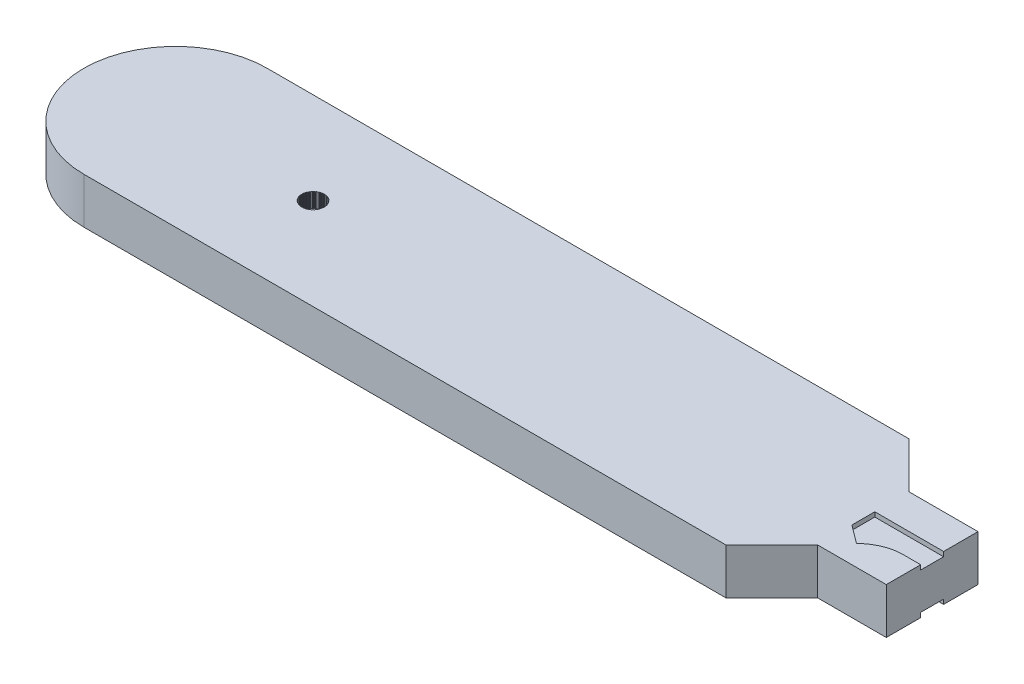
from build123d import *

# Parameters (mm, degrees)
BOSS_EXTRUDE1_DEPTH     = 10
CUT_EXTRUDE4_DEPTH      = 3.2
SKETCH2_R               = 5.5
CUT_EXTRUDE2_DEPTH      = 1.2
CUT_EXTRUDE3_DEPTH      = 1
CUT_EXTRUDE5_DEPTH      = 98.59610648
CUT_EXTRUDE5_DEPTH_BACK = 98.59610648
SKETCH6_W               = 15
SKETCH6_H               = 10
FILLET1_START           = -1
FILLET1_DEPTH           = 2
FILLET1_START_2         = 9
FILLET1_2_DEPTH         = 2
SKETCH7_W               = 40
SKETCH7_H               = 10
BOSS_EXTRUDE2_DEPTH     = 30
FILLET2_R               = 20
CHAMFER1_SIZE           = 10


with BuildPart() as part:
    # Sketch1 → Boss-Extrude1 (new body)
    with BuildSketch(Plane(origin=(0, 0, 0), x_dir=(1, 0, 0), z_dir=(0, 1, 0))):
        Polygon((-75, -20), (40, -20), (60, -20), (60, 0), (60, 20), (40, 20), (-75, 20), (-95, 20), (-95, -20), align=None)
    extrude(amount=BOSS_EXTRUDE1_DEPTH)

    # Sketch5 → Cut-Extrude4 (cut)
    with BuildSketch(Plane.XZ.offset(-10)):
        with BuildLine():
            Line((-74.866729582, 2.448604002), (-74.965733947, 2.352228083))
            Line((-74.965733947, 2.352228083), (-75.034266053, 2.352228083))
            Line((-75.034266053, 2.352228083), (-75.128339702, 2.448867388))
            ThreePointArc((-75.128339702, 2.448867388), (-75.213453001, 2.442920461), (-75.298307903, 2.43401622))
            Line((-75.298307903, 2.43401622), (-75.216789967, 2.390434282))
            Line((-75.216789967, 2.390434282), (-75.284946647, 2.383270726))
            Line((-75.284946647, 2.383270726), (-75.340727677, 2.428441314))
            ThreePointArc((-75.340727677, 2.428441314), (-75.442070784, 2.412052235), (-75.542639125, 2.391435833))
            Line((-75.542639125, 2.391435833), (-75.465470791, 2.354678511))
            Line((-75.465470791, 2.354678511), (-75.532505306, 2.340429885))
            Line((-75.532505306, 2.340429885), (-75.592702374, 2.379522318))
            ThreePointArc((-75.592702374, 2.379522318), (-75.686868648, 2.354067549), (-75.779948068, 2.324887863))
            Line((-75.779948068, 2.324887863), (-75.709051819, 2.293124389))
            Line((-75.709051819, 2.293124389), (-75.774229726, 2.271946803))
            Line((-75.774229726, 2.271946803), (-75.8381833, 2.304532777))
            ThreePointArc((-75.8381833, 2.304532777), (-75.923935855, 2.271511633), (-76.008391043, 2.23530089))
            Line((-76.008391043, 2.23530089), (-75.944864328, 2.206446317))
            Line((-75.944864328, 2.206446317), (-76.007471522, 2.178571798))
            Line((-76.007471522, 2.178571798), (-76.074480913, 2.204294293))
            ThreePointArc((-76.074480913, 2.204294293), (-76.151031117, 2.165305967), (-76.226168708, 2.123660251))
            Line((-76.226168708, 2.123660251), (-76.170324705, 2.095593957))
            Line((-76.170324705, 2.095593957), (-76.22967525, 2.061327903))
            Line((-76.22967525, 2.061327903), (-76.29900629, 2.0799051))
            ThreePointArc((-76.29900629, 2.0799051), (-76.365981918, 2.036545105), (-76.431511514, 1.991029218))
            Line((-76.431511514, 1.991029218), (-76.38296276, 1.961781831))
            Line((-76.38296276, 1.961781831), (-76.438406398, 1.921499669))
            Line((-76.438406398, 1.921499669), (-76.509299481, 1.932728031))
            ThreePointArc((-76.509299481, 1.932728031), (-76.566697253, 1.886500008), (-76.622679929, 1.838568033))
            Line((-76.622679929, 1.838568033), (-76.580448785, 1.806476012))
            Line((-76.580448785, 1.806476012), (-76.631378065, 1.760619083))
            Line((-76.631378065, 1.760619083), (-76.703056471, 1.764375589))
            ThreePointArc((-76.703056471, 1.764375589), (-76.751184067, 1.716617874), (-76.79797294, 1.667547862))
            Line((-76.79797294, 1.667547862), (-76.760619083, 1.631378065))
            Line((-76.760619083, 1.631378065), (-76.806476012, 1.580448785))
            Line((-76.806476012, 1.580448785), (-76.878154419, 1.576692279))
            ThreePointArc((-76.878154419, 1.576692279), (-76.917564529, 1.528518512), (-76.955739337, 1.479360067))
            Line((-76.955739337, 1.479360067), (-76.921499669, 1.438406398))
            Line((-76.921499669, 1.438406398), (-76.961781831, 1.38296276))
            Line((-76.961781831, 1.38296276), (-77.032674913, 1.371734398))
            ThreePointArc((-77.032674913, 1.371734398), (-77.064092329, 1.323988453), (-77.094388447, 1.275523264))
            Line((-77.094388447, 1.275523264), (-77.061327903, 1.22967525))
            Line((-77.061327903, 1.22967525), (-77.095593957, 1.170324705))
            Line((-77.095593957, 1.170324705), (-77.164924996, 1.151747509))
            ThreePointArc((-77.164924996, 1.151747509), (-77.189167426, 1.104974454), (-77.212399475, 1.057691414))
            Line((-77.212399475, 1.057691414), (-77.178571798, 1.007471522))
            Line((-77.178571798, 1.007471522), (-77.206446317, 0.944864328))
            Line((-77.206446317, 0.944864328), (-77.273455708, 0.919141833))
            ThreePointArc((-77.273455708, 0.919141833), (-77.291349904, 0.873577805), (-77.308331022, 0.827665666))
            Line((-77.308331022, 0.827665666), (-77.271946803, 0.774229726))
            Line((-77.271946803, 0.774229726), (-77.293124389, 0.709051819))
            Line((-77.293124389, 0.709051819), (-77.357077963, 0.676465846))
            ThreePointArc((-77.357077963, 0.676465846), (-77.369374437, 0.632050108), (-77.380834041, 0.587411127))
            Line((-77.380834041, 0.587411127), (-77.340429885, 0.532505306))
            Line((-77.340429885, 0.532505306), (-77.354678511, 0.465470791))
            Line((-77.354678511, 0.465470791), (-77.414875578, 0.426378358))
            ThreePointArc((-77.414875578, 0.426378358), (-77.422167277, 0.382790083), (-77.428672276, 0.339077482))
            Line((-77.428672276, 0.339077482), (-77.383270726, 0.284946647))
            Line((-77.383270726, 0.284946647), (-77.390434282, 0.216789967))
            Line((-77.390434282, 0.216789967), (-77.446215312, 0.17161938))
            ThreePointArc((-77.446215312, 0.17161938), (-77.448867388, 0.128339702), (-77.450753798, 0.085019897))
            Line((-77.450753798, 0.085019897), (-77.399999955, 0.034266053))
            Line((-77.399999955, 0.034266053), (-77.399999955, -0.034266053))
            Line((-77.399999955, -0.034266053), (-77.450753798, -0.085019897))
            ThreePointArc((-77.450753798, -0.085019897), (-77.448852521, -0.128623065), (-77.446175529, -0.17218549))
            Line((-77.446175529, -0.17218549), (-77.390434282, -0.216789967))
            Line((-77.390434282, -0.216789967), (-77.383270726, -0.284946647))
            Line((-77.383270726, -0.284946647), (-77.428441314, -0.340727677))
            ThreePointArc((-77.428441314, -0.340727677), (-77.42176959, -0.385298088), (-77.414279914, -0.429738364))
            Line((-77.414279914, -0.429738364), (-77.354678511, -0.465470791))
            Line((-77.354678511, -0.465470791), (-77.340429885, -0.532505306))
            Line((-77.340429885, -0.532505306), (-77.379522318, -0.592702374))
            ThreePointArc((-77.379522318, -0.592702374), (-77.367567191, -0.638786474), (-77.354719646, -0.684629793))
            Line((-77.354719646, -0.684629793), (-77.293124389, -0.709051819))
            Line((-77.293124389, -0.709051819), (-77.271946803, -0.774229726))
            Line((-77.271946803, -0.774229726), (-77.304532777, -0.8381833))
            ThreePointArc((-77.304532777, -0.8381833), (-77.286526732, -0.886125312), (-77.267523456, -0.933680855))
            Line((-77.267523456, -0.933680855), (-77.206446317, -0.944864328))
            Line((-77.206446317, -0.944864328), (-77.178571798, -1.007471522))
            Line((-77.178571798, -1.007471522), (-77.204294293, -1.074480913))
            ThreePointArc((-77.204294293, -1.074480913), (-77.179288011, -1.124333727), (-77.153154428, -1.173604947))
            Line((-77.153154428, -1.173604947), (-77.095593957, -1.170324705))
            Line((-77.095593957, -1.170324705), (-77.061327903, -1.22967525))
            Line((-77.061327903, -1.22967525), (-77.0799051, -1.29900629))
            ThreePointArc((-77.0799051, -1.29900629), (-77.046865484, -1.350468161), (-77.012552857, -1.401090134))
            Line((-77.012552857, -1.401090134), (-76.961781831, -1.38296276))
            Line((-76.961781831, -1.38296276), (-76.921499669, -1.438406398))
            Line((-76.921499669, -1.438406398), (-76.932728031, -1.509299481))
            ThreePointArc((-76.932728031, -1.509299481), (-76.890652821, -1.561683218), (-76.847158267, -1.612894572))
            Line((-76.847158267, -1.612894572), (-76.806476012, -1.580448785))
            Line((-76.806476012, -1.580448785), (-76.760619083, -1.631378065))
            Line((-76.760619083, -1.631378065), (-76.764375589, -1.703056471))
            ThreePointArc((-76.764375589, -1.703056471), (-76.712415138, -1.755293981), (-76.658908795, -1.805946891))
            Line((-76.658908795, -1.805946891), (-76.631378065, -1.760619083))
            Line((-76.631378065, -1.760619083), (-76.580448785, -1.806476012))
            Line((-76.580448785, -1.806476012), (-76.576692279, -1.878154419))
            ThreePointArc((-76.576692279, -1.878154419), (-76.514269593, -1.928836479), (-76.450218857, -1.977444773))
            Line((-76.450218857, -1.977444773), (-76.438406398, -1.921499669))
            Line((-76.438406398, -1.921499669), (-76.38296276, -1.961781831))
            Line((-76.38296276, -1.961781831), (-76.371734398, -2.032674913))
            ThreePointArc((-76.371734398, -2.032674913), (-76.298655216, -2.080124322), (-76.223936466, -2.12494755))
            Line((-76.223936466, -2.12494755), (-76.22967525, -2.061327903))
            Line((-76.22967525, -2.061327903), (-76.170324705, -2.095593957))
            Line((-76.170324705, -2.095593957), (-76.151747509, -2.164924996))
            ThreePointArc((-76.151747509, -2.164924996), (-76.068291818, -2.207300422), (-75.983279809, -2.246460189))
            Line((-75.983279809, -2.246460189), (-76.007471522, -2.178571798))
            Line((-76.007471522, -2.178571798), (-75.944864328, -2.206446317))
            Line((-75.944864328, -2.206446317), (-75.919141833, -2.273455708))
            ThreePointArc((-75.919141833, -2.273455708), (-75.826126742, -2.308882234), (-75.731750645, -2.340504979))
            Line((-75.731750645, -2.340504979), (-75.774229726, -2.271946803))
            Line((-75.774229726, -2.271946803), (-75.709051819, -2.293124389))
            Line((-75.709051819, -2.293124389), (-75.676465846, -2.357077963))
            ThreePointArc((-75.676465846, -2.357077963), (-75.575268296, -2.383797171), (-75.47302276, -2.406173733))
            Line((-75.47302276, -2.406173733), (-75.532505306, -2.340429885))
            Line((-75.532505306, -2.340429885), (-75.465470791, -2.354678511))
            Line((-75.465470791, -2.354678511), (-75.426378358, -2.414875578))
            ThreePointArc((-75.426378358, -2.414875578), (-75.318907018, -2.431403068), (-75.210808662, -2.443150071))
            Line((-75.210808662, -2.443150071), (-75.284946647, -2.383270726))
            Line((-75.284946647, -2.383270726), (-75.216789967, -2.390434282))
            Line((-75.216789967, -2.390434282), (-75.17161938, -2.446215312))
            ThreePointArc((-75.17161938, -2.446215312), (-75.060229867, -2.451488309), (-74.948715802, -2.451691762))
            Line((-74.948715802, -2.451691762), (-75.034266053, -2.399999955))
            Line((-75.034266053, -2.399999955), (-74.965733947, -2.399999955))
            Line((-74.965733947, -2.399999955), (-74.914980103, -2.450753798))
            ThreePointArc((-74.914980103, -2.450753798), (-74.802336284, -2.444248682), (-74.690110935, -2.432568875))
            Line((-74.690110935, -2.432568875), (-74.783210033, -2.390434282))
            Line((-74.783210033, -2.390434282), (-74.715053353, -2.383270726))
            Line((-74.715053353, -2.383270726), (-74.659272323, -2.428441314))
            ThreePointArc((-74.659272323, -2.428441314), (-74.548166734, -2.410242574), (-74.438013562, -2.386963302))
            Line((-74.438013562, -2.386963302), (-74.534529209, -2.354678511))
            Line((-74.534529209, -2.354678511), (-74.467494694, -2.340429885))
            Line((-74.467494694, -2.340429885), (-74.407297626, -2.379522318))
            ThreePointArc((-74.407297626, -2.379522318), (-74.300452623, -2.350331047), (-74.195034766, -2.316344866))
            Line((-74.195034766, -2.316344866), (-74.290948181, -2.293124389))
            Line((-74.290948181, -2.293124389), (-74.225770274, -2.271946803))
            Line((-74.225770274, -2.271946803), (-74.1618167, -2.304532777))
            ThreePointArc((-74.1618167, -2.304532777), (-74.061691973, -2.265612635), (-73.963367856, -2.222344789))
            Line((-73.963367856, -2.222344789), (-74.055135672, -2.206446317))
            Line((-74.055135672, -2.206446317), (-73.992528478, -2.178571798))
            Line((-73.992528478, -2.178571798), (-73.925519087, -2.204294293))
            ThreePointArc((-73.925519087, -2.204294293), (-73.834149531, -2.157363031), (-73.744825535, -2.106646535))
            Line((-73.744825535, -2.106646535), (-73.829675295, -2.095593957))
            Line((-73.829675295, -2.095593957), (-73.77032475, -2.061327903))
            Line((-73.77032475, -2.061327903), (-73.70099371, -2.0799051))
            ThreePointArc((-73.70099371, -2.0799051), (-73.619874896, -2.026987237), (-73.54090899, -1.970907402))
            Line((-73.54090899, -1.970907402), (-73.61703724, -1.961781831))
            Line((-73.61703724, -1.961781831), (-73.561593602, -1.921499669))
            Line((-73.561593602, -1.921499669), (-73.490700519, -1.932728031))
            ThreePointArc((-73.490700519, -1.932728031), (-73.420729585, -1.875987079), (-73.352889969, -1.816714372))
            Line((-73.352889969, -1.816714372), (-73.419551215, -1.806476012))
            Line((-73.419551215, -1.806476012), (-73.368621935, -1.760619083))
            Line((-73.368621935, -1.760619083), (-73.296943529, -1.764375589))
            ThreePointArc((-73.296943529, -1.764375589), (-73.238414289, -1.70594207), (-73.181888817, -1.645568076))
            Line((-73.181888817, -1.645568076), (-73.239380917, -1.631378065))
            Line((-73.239380917, -1.631378065), (-73.193523988, -1.580448785))
            Line((-73.193523988, -1.580448785), (-73.121845581, -1.576692279))
            ThreePointArc((-73.121845581, -1.576692279), (-73.074490972, -1.518498451), (-73.028938772, -1.458883203))
            Line((-73.028938772, -1.458883203), (-73.078500331, -1.438406398))
            Line((-73.078500331, -1.438406398), (-73.038218169, -1.38296276))
            Line((-73.038218169, -1.38296276), (-72.967325087, -1.371734398))
            ThreePointArc((-72.967325087, -1.371734398), (-72.930399333, -1.315361411), (-72.895036572, -1.257995043))
            Line((-72.895036572, -1.257995043), (-72.938672097, -1.22967525))
            Line((-72.938672097, -1.22967525), (-72.904406043, -1.170324705))
            Line((-72.904406043, -1.170324705), (-72.835075004, -1.151747509))
            ThreePointArc((-72.835075004, -1.151747509), (-72.80747115, -1.098289492), (-72.781187072, -1.044170367))
            Line((-72.781187072, -1.044170367), (-72.821428202, -1.007471522))
            Line((-72.821428202, -1.007471522), (-72.793553683, -0.944864328))
            Line((-72.793553683, -0.944864328), (-72.726544292, -0.919141833))
            ThreePointArc((-72.726544292, -0.919141833), (-72.706946554, -0.869096346), (-72.688450313, -0.818633379))
            Line((-72.688450313, -0.818633379), (-72.728053197, -0.774229726))
            Line((-72.728053197, -0.774229726), (-72.706875611, -0.709051819))
            Line((-72.706875611, -0.709051819), (-72.642922037, -0.676465846))
            ThreePointArc((-72.642922037, -0.676465846), (-72.629991905, -0.629669908), (-72.617990732, -0.582627161))
            Line((-72.617990732, -0.582627161), (-72.659570115, -0.532505306))
            Line((-72.659570115, -0.532505306), (-72.645321489, -0.465470791))
            Line((-72.645321489, -0.465470791), (-72.585124422, -0.426378358))
            ThreePointArc((-72.585124422, -0.426378358), (-72.577710835, -0.382018013), (-72.57111206, -0.337529165))
            Line((-72.57111206, -0.337529165), (-72.616729274, -0.284946647))
            Line((-72.616729274, -0.284946647), (-72.609565718, -0.216789967))
            Line((-72.609565718, -0.216789967), (-72.553784688, -0.17161938))
            ThreePointArc((-72.553784688, -0.17161938), (-72.551132612, -0.128339702), (-72.549246202, -0.085019897))
            Line((-72.549246202, -0.085019897), (-72.600000045, -0.034266053))
            Line((-72.600000045, -0.034266053), (-72.600000045, 0.034266053))
            Line((-72.600000045, 0.034266053), (-72.549246202, 0.085019897))
            ThreePointArc((-72.549246202, 0.085019897), (-72.551161797, 0.128895378), (-72.553862825, 0.172729519))
            Line((-72.553862825, 0.172729519), (-72.609565718, 0.216789967))
            Line((-72.609565718, 0.216789967), (-72.616729274, 0.284946647))
            Line((-72.616729274, 0.284946647), (-72.571558686, 0.340727677))
            ThreePointArc((-72.571558686, 0.340727677), (-72.578484541, 0.386892033), (-72.586287893, 0.432916188))
            Line((-72.586287893, 0.432916188), (-72.645321489, 0.465470791))
            Line((-72.645321489, 0.465470791), (-72.659570115, 0.532505306))
            Line((-72.659570115, 0.532505306), (-72.620477682, 0.592702374))
            ThreePointArc((-72.620477682, 0.592702374), (-72.633446854, 0.642533088), (-72.647459431, 0.692080512))
            Line((-72.647459431, 0.692080512), (-72.706875611, 0.709051819))
            Line((-72.706875611, 0.709051819), (-72.728053197, 0.774229726))
            Line((-72.728053197, 0.774229726), (-72.695467223, 0.8381833))
            ThreePointArc((-72.695467223, 0.8381833), (-72.715937257, 0.892457255), (-72.737685291, 0.946231854))
            Line((-72.737685291, 0.946231854), (-72.793553683, 0.944864328))
            Line((-72.793553683, 0.944864328), (-72.821428202, 1.007471522))
            Line((-72.821428202, 1.007471522), (-72.795705707, 1.074480913))
            ThreePointArc((-72.795705707, 1.074480913), (-72.825307638, 1.133197112), (-72.856473251, 1.191098501))
            Line((-72.856473251, 1.191098501), (-72.904406043, 1.170324705))
            Line((-72.904406043, 1.170324705), (-72.938672097, 1.22967525))
            Line((-72.938672097, 1.22967525), (-72.9200949, 1.29900629))
            ThreePointArc((-72.9200949, 1.29900629), (-72.960349747, 1.361341034), (-73.002472161, 1.422429293))
            Line((-73.002472161, 1.422429293), (-73.038218169, 1.38296276))
            Line((-73.038218169, 1.38296276), (-73.078500331, 1.438406398))
            Line((-73.078500331, 1.438406398), (-73.067271969, 1.509299481))
            ThreePointArc((-73.067271969, 1.509299481), (-73.119323707, 1.573683336), (-73.173519215, 1.636273359))
            Line((-73.173519215, 1.636273359), (-73.193523988, 1.580448785))
            Line((-73.193523988, 1.580448785), (-73.239380917, 1.631378065))
            Line((-73.239380917, 1.631378065), (-73.235624411, 1.703056471))
            ThreePointArc((-73.235624411, 1.703056471), (-73.300024726, 1.767344514), (-73.36676587, 1.829198962))
            Line((-73.36676587, 1.829198962), (-73.368621935, 1.760619083))
            Line((-73.368621935, 1.760619083), (-73.419551215, 1.806476012))
            Line((-73.419551215, 1.806476012), (-73.423307721, 1.878154419))
            ThreePointArc((-73.423307721, 1.878154419), (-73.499876853, 1.939859043), (-73.578858361, 1.998444146))
            Line((-73.578858361, 1.998444146), (-73.561593602, 1.921499669))
            Line((-73.561593602, 1.921499669), (-73.61703724, 1.961781831))
            Line((-73.61703724, 1.961781831), (-73.628265602, 2.032674913))
            ThreePointArc((-73.628265602, 2.032674913), (-73.716046396, 2.089230889), (-73.806155365, 2.141998494))
            Line((-73.806155365, 2.141998494), (-73.77032475, 2.061327903))
            Line((-73.77032475, 2.061327903), (-73.829675295, 2.095593957))
            Line((-73.829675295, 2.095593957), (-73.848252491, 2.164924996))
            ThreePointArc((-73.848252491, 2.164924996), (-73.94556429, 2.213953002), (-74.044958042, 2.258609622))
            Line((-74.044958042, 2.258609622), (-73.992528478, 2.178571798))
            Line((-73.992528478, 2.178571798), (-74.055135672, 2.206446317))
            Line((-74.055135672, 2.206446317), (-74.080858167, 2.273455708))
            ThreePointArc((-74.080858167, 2.273455708), (-74.185440024, 2.312988242), (-74.291715117, 2.347712736))
            Line((-74.291715117, 2.347712736), (-74.225770274, 2.271946803))
            Line((-74.225770274, 2.271946803), (-74.290948181, 2.293124389))
            Line((-74.290948181, 2.293124389), (-74.323534154, 2.357077963))
            ThreePointArc((-74.323534154, 2.357077963), (-74.432749008, 2.385717686), (-74.543166402, 2.409299821))
            Line((-74.543166402, 2.409299821), (-74.467494694, 2.340429885))
            Line((-74.467494694, 2.340429885), (-74.534529209, 2.354678511))
            Line((-74.534529209, 2.354678511), (-74.573621642, 2.414875578))
            ThreePointArc((-74.573621642, 2.414875578), (-74.684683245, 2.431871277), (-74.796406769, 2.443761928))
            Line((-74.796406769, 2.443761928), (-74.715053353, 2.383270726))
            Line((-74.715053353, 2.383270726), (-74.783210033, 2.390434282))
            Line((-74.783210033, 2.390434282), (-74.82838062, 2.446215312))
            ThreePointArc((-74.82838062, 2.446215312), (-74.847550423, 2.447484768), (-74.866729582, 2.448604002))
        make_face()
    extrude(amount=CUT_EXTRUDE4_DEPTH, mode=Mode.SUBTRACT)

    # Sketch2 → Cut-Extrude2 (cut)
    with BuildSketch(Plane(origin=(0, 0, 0), x_dir=(1, 0, 0), z_dir=(0, 1, 0))):
        with Locations(Location((-75, 0, 0), (0, 0, 270))):
            Circle(SKETCH2_R)
    extrude(amount=CUT_EXTRUDE2_DEPTH, mode=Mode.SUBTRACT)

    # Sketch3 → Cut-Extrude3 (cut)
    with BuildSketch(Plane(origin=(0, 10, 0), x_dir=(1, 0, 0), z_dir=(0, 1, 0))):
        Polygon((60, 2.5), (45, 2.5), (45, -2.5), (49, -5.5), (49, -2.5), (60, -2.5), align=None)
    cut_extrude3 = extrude(amount=-CUT_EXTRUDE3_DEPTH, mode=Mode.SUBTRACT)

    # Mirror1: Cut-Extrude3 across plane
    add(cut_extrude3.mirror(Plane.ZX.offset(5)), mode=Mode.SUBTRACT)

    # Sketch6 → Cut-Extrude5 (cut, two sides: drawn at the far end of the back side and taken through both)
    with BuildSketch(Plane(origin=(0, 10, 0), x_dir=(1, 0, 0), z_dir=(0, 1, 0)).offset(-CUT_EXTRUDE5_DEPTH_BACK)):
        with Locations((52.5, -15)):
            Rectangle(SKETCH6_W, SKETCH6_H)
        with Locations((52.5, 15)):
            Rectangle(SKETCH6_W, SKETCH6_H)
    extrude(amount=CUT_EXTRUDE5_DEPTH + CUT_EXTRUDE5_DEPTH_BACK, mode=Mode.SUBTRACT)

    # Fillet1: read off the stored shape, not the designer's step
    # Fillet1 outline → Fillet1 (cut)
    with BuildSketch(Plane(origin=(0, 0, 0), x_dir=(1, 0, 0), z_dir=(0, 1, 0)).offset(FILLET1_START)):
        with BuildLine():
            Line((49, -2.5), (49, -5.5))
            add(Edge.make_bspline(
                [(49, -5.5), (51.940588176, -2.5), (56.141428429, -2.5)],
                knots=[0, 0, 0, 1, 1, 1], degree=2, weights=[1, 0.921954446, 1]))
            Line((56.141428429, -2.5), (49, -2.5))
        make_face()
    extrude(amount=FILLET1_DEPTH, mode=Mode.SUBTRACT)

    # Fillet1 2 outline → Fillet1 2 (cut)
    with BuildSketch(Plane(origin=(0, 0, 0), x_dir=(1, 0, 0), z_dir=(0, 1, 0)).offset(FILLET1_START_2)):
        with BuildLine():
            Line((49, -2.5), (49, -5.5))
            add(Edge.make_bspline(
                [(49, -5.5), (51.940588176, -2.5), (56.141428429, -2.5)],
                knots=[0, 0, 0, 1, 1, 1], degree=2, weights=[1, 0.921954446, 1]))
            Line((56.141428429, -2.5), (49, -2.5))
        make_face()
    extrude(amount=FILLET1_2_DEPTH, mode=Mode.SUBTRACT)

    # Sketch7 → Boss-Extrude2 (add)
    with BuildSketch(Plane.ZY.offset(95)):
        with Locations((0, 5)):
            Rectangle(SKETCH7_W, SKETCH7_H)
    extrude(amount=BOSS_EXTRUDE2_DEPTH)

    # Fillet2
    fillet2_edges = [part.edges().sort_by_distance(p)[0] for p in [
        (-125, 5, -20),
        (-125, 5, 20),
    ]]
    fillet(fillet2_edges, radius=FILLET2_R - 0.0001)  # a hair under: the kernel refuses the full size

    # Chamfer1
    chamfer1_edges = [part.edges().sort_by_distance(p)[0] for p in [
        (45, 5, 20),
        (45, 5, -20),
    ]]
    chamfer(chamfer1_edges, length=CHAMFER1_SIZE - 0.0001)  # a hair under: the kernel refuses the full size


solid = part.part
